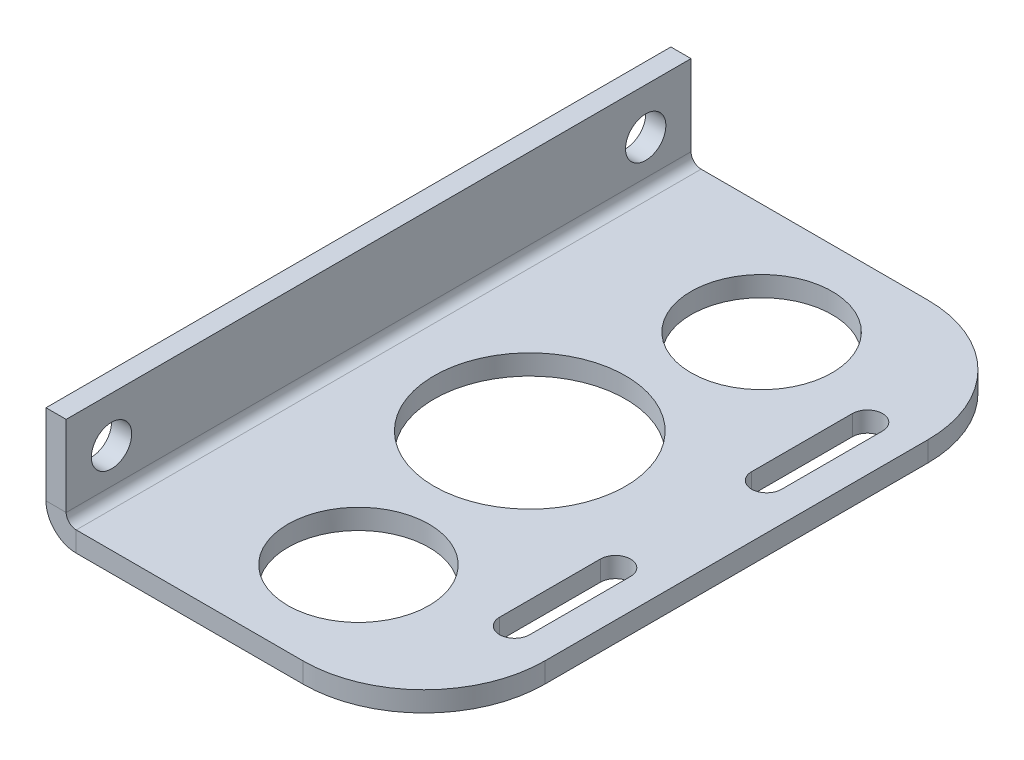
from build123d import *

# Parameters (mm, degrees)
EXTRUDE_1_DEPTH       = 31
SKETCH_2_R            = 2
CUT_EXTRUDE_1_DEPTH   = 49.396797415
SKETCH_3_R            = 9.5
SKETCH_3_R_2          = 7
CUT_EXTRUDE_2_DEPTH   = 50.479793856
FILLET_1_R            = 12
SHEET_START           = -31
SHEET_METAL_1_DEPTH   = 62
SHEET_METAL_1_2_DEPTH = 62


# Read off the part's stored shape, not the designer's step: 转换实体1
with BuildPart() as part:
    # Sketch 1 → 拉伸-薄壁1 (new, symmetric)
    with BuildSketch(Plane.XY):
        Polygon((0, 11), (0, 0), (37.5, 0), (37.5, 2), (2, 2), (2, 11), align=None)
    extrude(amount=EXTRUDE_1_DEPTH, both=True)

    # Sketch 2 → 切除-拉伸1 (cut, through all)
    with BuildSketch(Plane(origin=(2, 0, 0), x_dir=(0, 0, -1), z_dir=(1, 0, 0))):
        with Locations(Location((-26.5, 6.5, 0), (0, 0, 90))):
            Circle(SKETCH_2_R)
        with Locations(Location((26.5, 6.5, 0), (0, 0, 270))):
            Circle(SKETCH_2_R)
    extrude(amount=-CUT_EXTRUDE_1_DEPTH, mode=Mode.SUBTRACT)

    # 草图3 → 切除-拉伸2 (cut, through all)
    with BuildSketch(Plane(origin=(0, 2, 0), x_dir=(1, 0, 0), z_dir=(0, 1, 0))):
        with Locations(Location((17, 0, 0), (0, 0, 270))):
            Circle(SKETCH_3_R)
        with Locations(Location((20, 20, 0), (0, 0, 270))):
            Circle(SKETCH_3_R_2)
        with Locations(Location((20, -20, 0), (0, 0, 90))):
            Circle(SKETCH_3_R_2)
        with BuildLine():
            Line((34.5, -7.5), (34.5, -17.5))
            ThreePointArc((34.5, -17.5), (33, -19), (31.5, -17.5))
            Line((31.5, -17.5), (31.5, -7.5))
            ThreePointArc((31.5, -7.5), (33, -6), (34.5, -7.5))
        make_face()
        with BuildLine():
            Line((34.5, 7.5), (34.5, 17.5))
            ThreePointArc((34.5, 17.5), (33, 19), (31.5, 17.5))
            Line((31.5, 17.5), (31.5, 7.5))
            ThreePointArc((31.5, 7.5), (33, 6), (34.5, 7.5))
        make_face()
    extrude(amount=-CUT_EXTRUDE_2_DEPTH, mode=Mode.SUBTRACT)

    # 圆角1
    fillet_1_edges = [part.edges().sort_by_distance(p)[0] for p in [
        (37.5, 1, -31),
        (37.5, 1, 31),
    ]]
    fillet(fillet_1_edges, radius=FILLET_1_R)

    # Sheet Metal 1 outline → Sheet Metal 1 (cut)
    with BuildSketch(Plane.XY.offset(SHEET_START)):
        with BuildLine():
            ThreePointArc((3, 0), (0.878679656, 0.878679656), (0, 3))
            Line((0, 3), (0, 0))
            Line((0, 0), (3, 0))
        make_face()
    extrude(amount=SHEET_METAL_1_DEPTH, mode=Mode.SUBTRACT)

    # Sheet Metal 1 2 outline → Sheet Metal 1 2 (add)
    with BuildSketch(Plane.XY.offset(SHEET_START)):
        with BuildLine():
            ThreePointArc((3, 2), (2.292893219, 2.292893219), (2, 3))
            Line((2, 3), (2, 2))
            Line((2, 2), (3, 2))
        make_face()
    extrude(amount=SHEET_METAL_1_2_DEPTH)


solid = part.part
